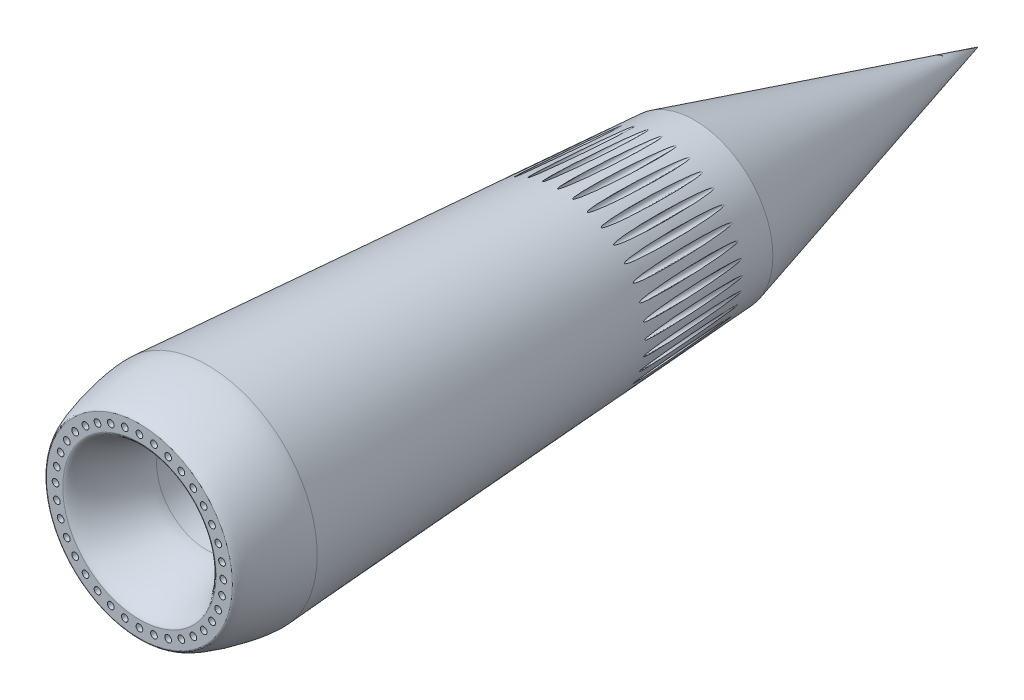
from build123d import *

# Parameters (mm, degrees)
SKETCH1_R          = 0.1
SKETCH1_R_2        = 1.487370173
CUT_EXTRUDE5_DEPTH = 18
FILLET10_SIZE      = 0.8
FILLET10_SIZE_2    = 2


with BuildPart() as part:
    # Sketch3 → Revolve1 (revolve)
    with BuildSketch(Plane(origin=(0, 0, 0), x_dir=(0, 0, -1), z_dir=(1, 0, 0)), mode=Mode.PRIVATE) as revolve1_sk:
        Polygon((0, 0), (25, 0), (16.546268292, -2.338346543), (0, -3.4), align=None)
    revolve(revolve1_sk.sketch.rotate(Axis((0, 0, 0), (0, 0, -1)), 270), axis=Axis((0, 0, 0), (0, 0, -1)))

    # Sketch1 → Cut-Extrude5 (cut)
    with BuildSketch(Plane.XY):
        with Locations((-1.606969024, 1.915111108)):
            Circle(SKETCH1_R)
        with Locations((-1.25, 2.165063509)):
            Circle(SKETCH1_R)
        with Locations((-0.855050358, 2.349231552)):
            Circle(SKETCH1_R)
        with Locations((-0.434120444, 2.462019383)):
            Circle(SKETCH1_R)
        with Locations((0, 2.5)):
            Circle(SKETCH1_R)
        with Locations((0.434120444, 2.462019383)):
            Circle(SKETCH1_R)
        with Locations((0.855050358, 2.349231552)):
            Circle(SKETCH1_R)
        with Locations((1.25, 2.165063509)):
            Circle(SKETCH1_R)
        with Locations((1.606969024, 1.915111108)):
            Circle(SKETCH1_R)
        with Locations((1.915111108, 1.606969024)):
            Circle(SKETCH1_R)
        with Locations((2.165063509, 1.25)):
            Circle(SKETCH1_R)
        with Locations((2.349231552, 0.855050358)):
            Circle(SKETCH1_R)
        with Locations((2.462019383, 0.434120444)):
            Circle(SKETCH1_R)
        with Locations((2.349231552, -0.855050358)):
            Circle(SKETCH1_R)
        with Locations((2.462019383, -0.434120444)):
            Circle(SKETCH1_R)
        with Locations((1.25, -2.165063509)):
            Circle(SKETCH1_R)
        with Locations((1.606969024, -1.915111108)):
            Circle(SKETCH1_R)
        with Locations((1.915111108, -1.606969024)):
            Circle(SKETCH1_R)
        with Locations((2.165063509, -1.25)):
            Circle(SKETCH1_R)
        with Locations((2.5, 0)):
            Circle(SKETCH1_R)
        with Locations((0.434120444, -2.462019383)):
            Circle(SKETCH1_R)
        with Locations((0.855050358, -2.349231552)):
            Circle(SKETCH1_R)
        with Locations((-0.434120444, -2.462019383)):
            Circle(SKETCH1_R)
        with Locations((-0.855050358, -2.349231552)):
            Circle(SKETCH1_R)
        with Locations((0, -2.5)):
            Circle(SKETCH1_R)
        with Locations((-1.25, -2.165063509)):
            Circle(SKETCH1_R)
        with Locations((-1.915111108, -1.606969024)):
            Circle(SKETCH1_R)
        with Locations((-1.606969024, -1.915111108)):
            Circle(SKETCH1_R)
        with Locations((-2.462019383, -0.434120444)):
            Circle(SKETCH1_R)
        with Locations((-2.349231552, -0.855050358)):
            Circle(SKETCH1_R)
        with Locations((-2.165063509, -1.25)):
            Circle(SKETCH1_R)
        with Locations((-2.349231552, 0.855050358)):
            Circle(SKETCH1_R)
        with Locations((-2.462019383, 0.434120444)):
            Circle(SKETCH1_R)
        with Locations((-2.5, 0)):
            Circle(SKETCH1_R)
        with Locations((-1.915111108, 1.606969024)):
            Circle(SKETCH1_R)
        with Locations((-2.165063509, 1.25)):
            Circle(SKETCH1_R)
        Circle(SKETCH1_R_2)
    extrude(amount=-CUT_EXTRUDE5_DEPTH, mode=Mode.SUBTRACT)

    # Fillet9
    # a fillet whose section is not a circle: 2, 0.5 mm, written as the material it takes off along each edge
    with BuildSketch(Plane(origin=(0, 0, 0), x_dir=(1, 0, 0), z_dir=(0, 1, 0))) as fillet9_piece_1:
        with BuildLine():
            Bezier((3.269620372, 2.032015522), (3.4, 0), (2.770646418, 0), weights=[1, 0.25, 1])
            Line((2.770646418, 0), (3.4, 0))
            Line((3.4, 0), (3.269620372, 2.032015522))
        make_face()
    revolve(axis=Axis((0, 0, 0), (0, 0, -1)), mode=Mode.SUBTRACT)

    # Fillet10
    # a fillet whose section is not a circle: 2, 0.8 mm, written as the material it takes off along each edge
    with BuildSketch(Plane(origin=(0, 0, 0), x_dir=(1, 0, 0), z_dir=(0, -1, 0))) as fillet10_piece_1:
        with BuildLine():
            Bezier((1.487370173 + FILLET10_SIZE, 0), (1.487370173, 0), (1.487370173, -FILLET10_SIZE_2), weights=[1, 0.25, 1])
            Line((1.487370173, -FILLET10_SIZE_2), (1.487370173, 0))
            Line((1.487370173, 0), (1.487370173 + FILLET10_SIZE, 0))
        make_face()
    revolve(axis=Axis((0, 0, 0), (0, 0, 1)), mode=Mode.SUBTRACT)


solid = part.part
